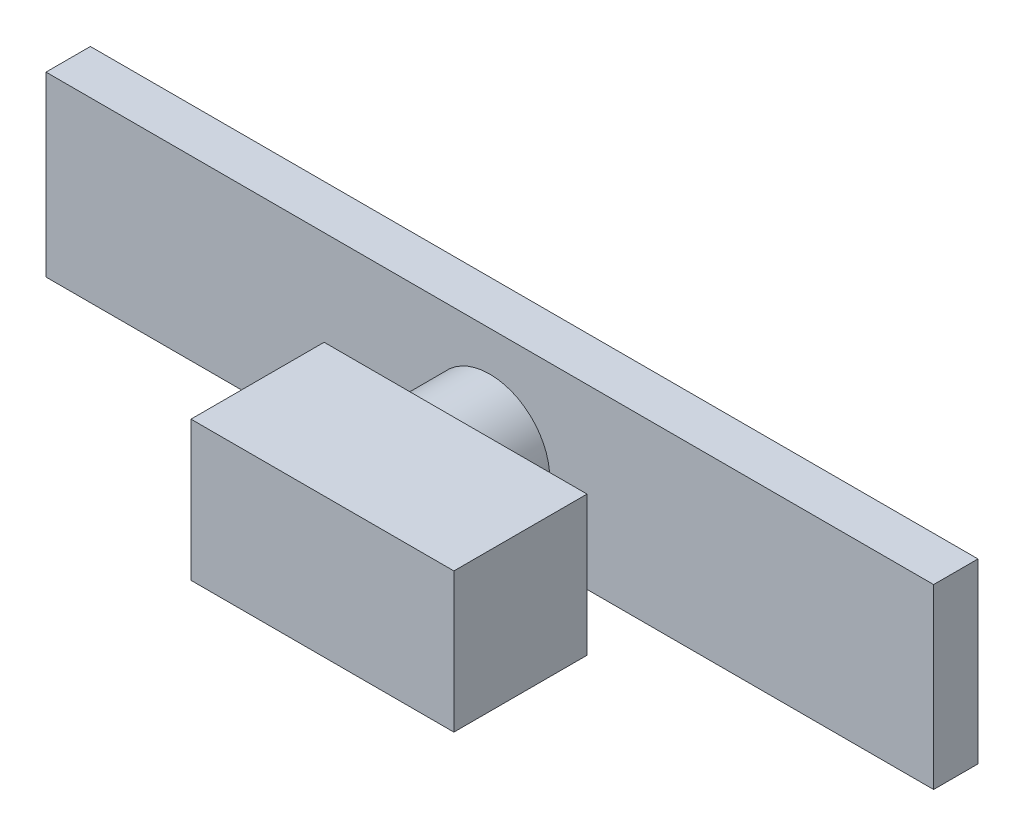
from build123d import *

# Parameters (mm, degrees)
SKETCH2_W             = 254
SKETCH2_H             = 12.7
BOSS_EXTRUDE1_DEPTH   = 50.8
SKETCH3_R             = 17.140791438
BOSS_EXTRUDE2_DEPTH   = 19.05
SKETCH4_W             = 75.235944222
SKETCH4_H             = 39.955088207
BOSS_EXTRUDE3_DEPTH   = 38.1
SCALE2_SCALE          = 0.06
BODY_MOVE_COPY1_ANGLE = 90
SCALE5_SCALE          = 0.25


with BuildPart() as part:
    # Sketch2 → Boss-Extrude1 (new body)
    with BuildSketch(Plane.XY):
        with Locations((79.130769231, 14.898076923)):
            Rectangle(SKETCH2_W, SKETCH2_H)
    extrude(amount=BOSS_EXTRUDE1_DEPTH)

    # Sketch3 → Boss-Extrude2 (add)
    with BuildSketch(Plane(origin=(0, 21.248076923, 0), x_dir=(1, 0, 0), z_dir=(0, 1, 0))):
        with Locations((79.130769231, -28.483063876)):
            Circle(SKETCH3_R)
    extrude(amount=BOSS_EXTRUDE2_DEPTH)

    # Sketch4 → Boss-Extrude3 (add)
    with BuildSketch(Plane(origin=(0, 40.298076923, 0), x_dir=(1, 0, 0), z_dir=(0, 1, 0))):
        with Locations((88.38546847, -28.088530296)):
            Rectangle(SKETCH4_W, SKETCH4_H)
    extrude(amount=BOSS_EXTRUDE3_DEPTH)


with BuildPart() as part_1:
    # Scale2: scaled about (82.711857342, 33.041003565, 26.623476887)
    add(part.part.scale(SCALE2_SCALE).moved(Location((77.749145901, 31.058543351, 25.026068274))))


with BuildPart() as part_2:
    # Body-Move/Copy1: moved
    add(part_1.part.rotate(Axis((0, 33.666927966, 26.550068274), (1, 0, 0)), BODY_MOVE_COPY1_ANGLE))


with BuildPart() as part_3:
    # Body-Move/Copy3: moved
    add(part_2.part.moved(Location((-50.8, 0, -50.8))))


with BuildPart() as part_4:
    # Scale5: scaled about (31.911857342, 33.593519353, -24.875856127)
    add(part_3.part.scale(SCALE5_SCALE).moved(Location((23.933893006, 25.195139515, -18.656892095))))


with BuildPart() as part_5:
    # Body-Move/Copy4: moved
    add(part_4.part.moved(Location((-50.8, 0, 50.8))))


solid = part_5.part
